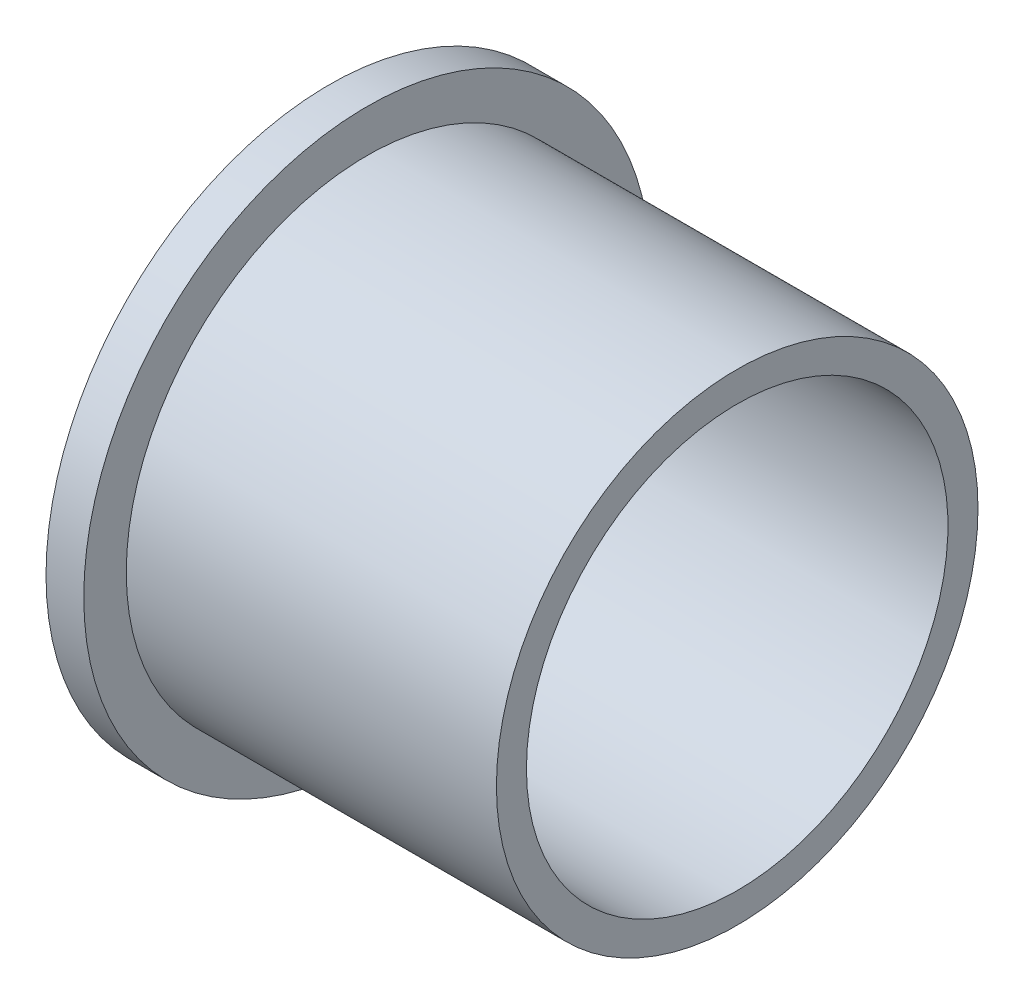
from build123d import *


with BuildPart() as part:
    # Revolve Sketch → Revolve Body (revolve)
    with BuildSketch(Plane.XY):
        Polygon((0, 190.5), (0, 141.732), (274.32, 141.732), (274.32, 161.925), (25.4, 161.925), (25.4, 190.5), align=None)
    revolve(axis=Axis((0, 0, 0), (1, 0, 0)))


solid = part.part
